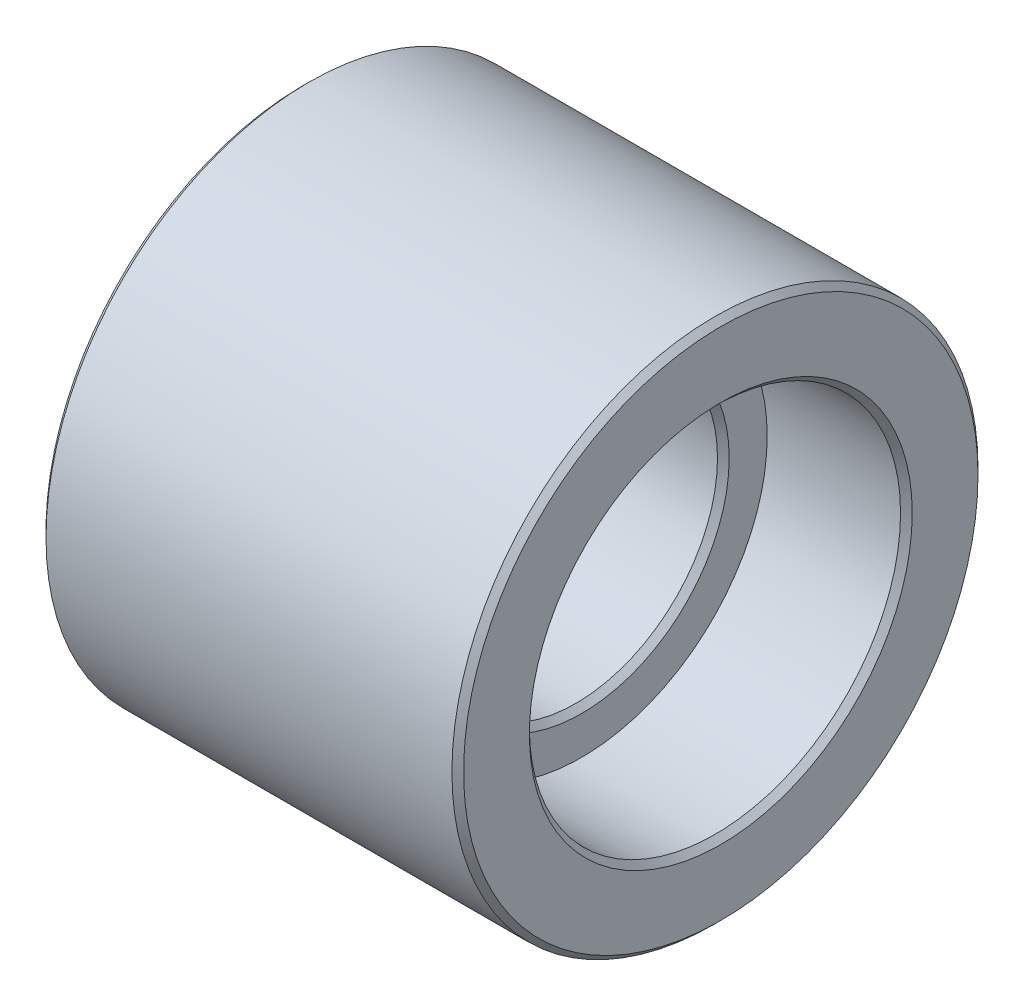
from build123d import *

# Parameters (mm, degrees)
CHAMFER1_SIZE = 0.2


with BuildPart() as part:
    # Sketch1 → Revolve1 (revolve)
    with BuildSketch(Plane(origin=(0, 0, 0), x_dir=(1, 0, 0), z_dir=(0, 1, 0))):
        Polygon((7.14375, 9), (-7.14375, 9), (-7.14375, 6.35), (-2.38125, 6.35), (-2.38125, 4.85), (2.38125, 4.85), (2.38125, 6.35), (7.14375, 6.35), align=None)
    revolve(axis=Axis((0, 0, 0), (1, 0, 0)))

    # Chamfer1
    chamfer1_edges = [part.edges().sort_by_distance(p)[0] for p in [
        (7.14375, 0, 9),
        (-7.14375, 0, 9),
        (-7.14375, 0, 6.35),
        (-2.38125, 0, 4.85),
        (2.38125, 0, 4.85),
        (7.14375, 0, 6.35),
    ]]
    chamfer(chamfer1_edges, length=CHAMFER1_SIZE)


solid = part.part
